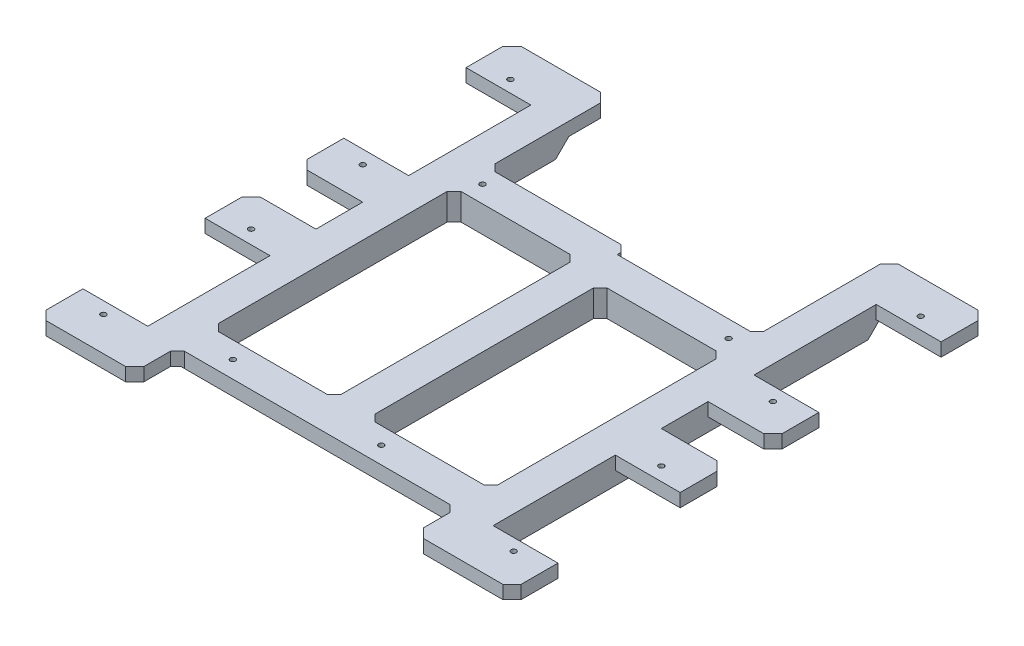
from build123d import *

# Parameters (mm, degrees)
SKETCH1_W               = 89.4
SKETCH1_H               = 89.4
SKETCH1_R               = 0.5
BOSS_EXTRUDE1_DEPTH     = 2.5
SKETCH5_W               = 65
SKETCH5_H               = 74
BOSS_EXTRUDE3_DEPTH     = 2.5
SKETCH7_R               = 0.5
CUT_EXTRUDE2_DEPTH      = 4
CUT_EXTRUDE1_DEPTH      = 64.412774738
CUT_EXTRUDE1_DEPTH_BACK = 64.412774738
SKETCH2_W               = 12.2
SKETCH2_H               = 23
SKETCH2_W_2             = 52.6
SKETCH2_H_2             = 8.025
SKETCH2_W_3             = 23.1
SKETCH2_H_3             = 45.67
SKETCH2_H_4             = 43.68
SKETCH2_H_5             = 8.8
CHAMFER2_SIZE           = 1.3
CHAMFER3_SIZE           = 1.3
CHAMFER4_SIZE           = 1.7
CHAMFER5_SIZE           = 2.5


with BuildPart() as part:
    # Sketch1 → Boss-Extrude1 (new body)
    with BuildSketch(Plane(origin=(0, 0, 0), x_dir=(1, 0, 0), z_dir=(0, 1, 0))):
        Rectangle(SKETCH1_W, SKETCH1_H)
        with Locations(Location((-38.6, 38.3, 0), (0, 0, 270))):
            Circle(SKETCH1_R, mode=Mode.SUBTRACT)
        with Locations(Location((-38.6, 10.5, 0), (0, 0, 270))):
            Circle(SKETCH1_R, mode=Mode.SUBTRACT)
        with Locations(Location((-38.6, -10.5, 0), (0, 0, 270))):
            Circle(SKETCH1_R, mode=Mode.SUBTRACT)
        with Locations(Location((-38.6, -38.3, 0), (0, 0, 270))):
            Circle(SKETCH1_R, mode=Mode.SUBTRACT)
        with Locations(Location((38.6, -38.3, 0), (0, 0, 90))):
            Circle(SKETCH1_R, mode=Mode.SUBTRACT)
        with Locations(Location((38.6, -10.5, 0), (0, 0, 90))):
            Circle(SKETCH1_R, mode=Mode.SUBTRACT)
        with Locations(Location((38.6, 10.5, 0), (0, 0, 90))):
            Circle(SKETCH1_R, mode=Mode.SUBTRACT)
        with Locations(Location((38.6, 38.3, 0), (0, 0, 90))):
            Circle(SKETCH1_R, mode=Mode.SUBTRACT)
    extrude(amount=BOSS_EXTRUDE1_DEPTH)

    # Sketch5 → Boss-Extrude3 (add)
    with BuildSketch(Plane.XZ):
        Rectangle(SKETCH5_W, SKETCH5_H)
    extrude(amount=BOSS_EXTRUDE3_DEPTH)

    # Sketch7 → Cut-Extrude2 (cut)
    with BuildSketch(Plane(origin=(0, 2.5, 0), x_dir=(1, 0, 0), z_dir=(0, 1, 0))):
        with Locations(Location((-24.15, 18.595, 0), (0, 0, 270))):
            Circle(SKETCH7_R)
        with Locations(Location((24.15, 16.605, 0), (0, 0, 270))):
            Circle(SKETCH7_R)
        with Locations(Location((-19.07, -33.475, 0), (0, 0, 270))):
            Circle(SKETCH7_R)
        with Locations(Location((8.86, -33.475, 0), (0, 0, 270))):
            Circle(SKETCH7_R)
    extrude(amount=-CUT_EXTRUDE2_DEPTH, mode=Mode.SUBTRACT)

    # Sketch2 → Cut-Extrude1 (cut, two sides: drawn at the far end of the back side and taken through both)
    with BuildSketch(Plane(origin=(0, 2.5, 0), x_dir=(1, 0, 0), z_dir=(0, 1, 0)).offset(-CUT_EXTRUDE1_DEPTH_BACK)):
        with Locations((-38.6, 24.55)):
            Rectangle(SKETCH2_W, SKETCH2_H)
        Polygon((-26.3, 44.7), (26.3, 44.7), (26.3, 24.23), (26.3, 19.805), (0, 19.805), (0, 21.795), (-26.3, 21.795), align=None)
        with Locations((0, -40.6875)):
            Rectangle(SKETCH2_W_2, SKETCH2_H_2)
        with Locations((-14.75, -7.44)):
            Rectangle(SKETCH2_W_3, SKETCH2_H_3)
        with Locations((14.75, -8.435)):
            Rectangle(SKETCH2_W_3, SKETCH2_H_4)
        with Locations((-38.6, 0)):
            Rectangle(SKETCH2_W, SKETCH2_H_5)
        with Locations((38.6, 0)):
            Rectangle(SKETCH2_W, SKETCH2_H_5)
        with Locations((38.6, 24.55)):
            Rectangle(SKETCH2_W, SKETCH2_H)
        with Locations((38.6, -24.55)):
            Rectangle(SKETCH2_W, SKETCH2_H)
        with Locations((-38.6, -24.55)):
            Rectangle(SKETCH2_W, SKETCH2_H)
    extrude(amount=CUT_EXTRUDE1_DEPTH + CUT_EXTRUDE1_DEPTH_BACK, mode=Mode.SUBTRACT)

    # Chamfer2
    chamfer2_edges = [part.edges().sort_by_distance(p)[0] for p in [
        (0, 0, -21.795),
    ]]
    chamfer(chamfer2_edges, length=CHAMFER2_SIZE)

    # Chamfer3
    chamfer3_edges = [part.edges().sort_by_distance(p)[0] for p in [
        (-26.3, 0, -21.795),
        (26.3, 0, 36.675),
        (-26.3, 0, 36.675),
        (-26.3, 0, 30.275),
        (-3.2, 0, 30.275),
        (3.2, 0, 30.275),
        (26.3, 0, 30.275),
        (-3.2, 0, -15.395),
        (3.2, 0, -13.405),
        (26.3, 0, -13.405),
        (26.3, 0, -19.805),
        (-26.3, 0, -15.395),
    ]]
    chamfer(chamfer3_edges, length=CHAMFER3_SIZE)

    # Chamfer4
    chamfer4_edges = [part.edges().sort_by_distance(p)[0] for p in [
        (26.3, 1.25, 44.7),
        (-26.3, 1.25, 44.7),
        (-44.7, 1.25, 4.4),
        (-44.7, 1.25, -4.4),
        (-26.3, 1.25, -44.7),
        (26.3, 1.25, -44.7),
        (44.7, 1.25, -4.4),
        (44.7, 1.25, 4.4),
        (-44.7, 1.25, -44.7),
        (44.7, 1.25, -44.7),
        (44.7, 1.25, 44.7),
        (-44.7, 1.25, 44.7),
    ]]
    chamfer(chamfer4_edges, length=CHAMFER4_SIZE)

    # Chamfer5
    chamfer5_edges = [part.edges().sort_by_distance(p)[0] for p in [
        (28.9125, -2.5, 37),
        (29.4, -2.5, -37),
        (-29.4, -2.5, -37),
    ]]
    chamfer(chamfer5_edges, length=CHAMFER5_SIZE - 0.0001)  # a hair under: the kernel refuses the full size


solid = part.part
